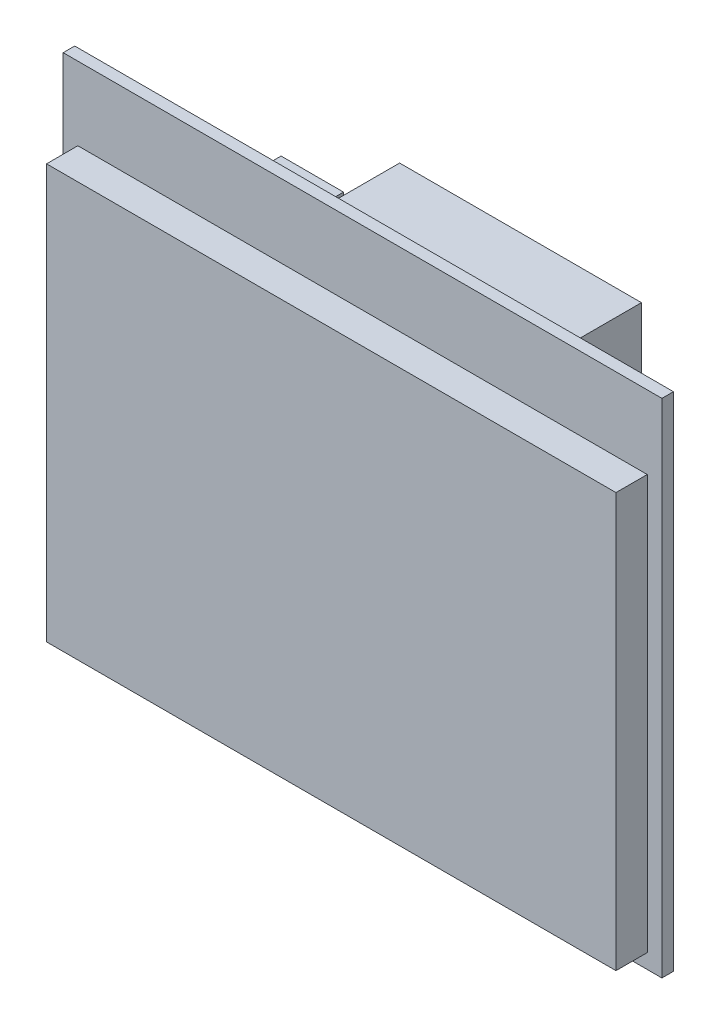
from build123d import *

# Parameters (mm, degrees)
SKETCH1_W           = 81.7
SKETCH1_H           = 68.5
BOSS_EXTRUDE1_DEPTH = 1.5748
SKETCH2_W           = 77.7
SKETCH2_H           = 56.5
BOSS_EXTRUDE2_DEPTH = 4.27
SKETCH3_W           = 33
SKETCH3_H           = 8.96
BOSS_EXTRUDE3_DEPTH = 8.87
SKETCH4_W           = 8.525
SKETCH4_H           = 5.225
BOSS_EXTRUDE4_DEPTH = 4


with BuildPart() as part:
    # Sketch1 → Boss-Extrude1 (new body)
    with BuildSketch(Plane.XY):
        with Locations((2.85, 3.75)):
            Rectangle(SKETCH1_W, SKETCH1_H)
    extrude(amount=BOSS_EXTRUDE1_DEPTH)

    # Sketch2 → Boss-Extrude2 (add)
    with BuildSketch(Plane.XY.offset(1.5748)):
        with Locations((2.85, -0.25)):
            Rectangle(SKETCH2_W, SKETCH2_H)
    extrude(amount=BOSS_EXTRUDE2_DEPTH)

    # Sketch3 → Boss-Extrude3 (add)
    with BuildSketch(Plane(origin=(0, 0, 0), x_dir=(-1, 0, 0), z_dir=(0, 0, -1))):
        with Locations((-13.963928356, 32.987923885)):
            Rectangle(SKETCH3_W, SKETCH3_H)
    extrude(amount=BOSS_EXTRUDE3_DEPTH)

    # Sketch4 → Boss-Extrude4 (add)
    with BuildSketch(Plane(origin=(0, 0, 0), x_dir=(-1, 0, 0), z_dir=(0, 0, -1))):
        with Locations((9.578571644, 32.46504444)):
            Rectangle(SKETCH4_W, SKETCH4_H)
    extrude(amount=BOSS_EXTRUDE4_DEPTH)


solid = part.part
